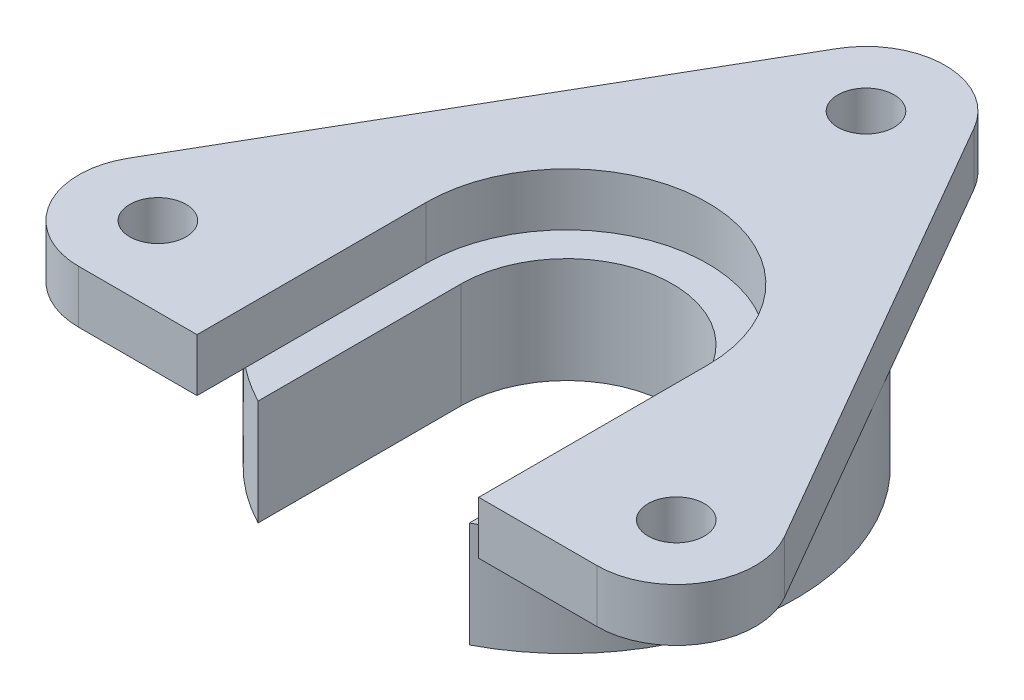
from build123d import *

# Parameters (mm, degrees)
SKETCH_1_R          = 13
SKETCH_1_R_2        = 6
EXTRUDE_1_DEPTH     = 6
SKETCH_2_R          = 8
EXTRUDE_2_DEPTH     = 3
CUT_EXTRUDE_1_DEPTH = 47.127561032
OTHER_START         = -30
OTHER_1_OUTLINE_R   = 1.6
OTHER_1_DEPTH       = 3


# Read off the part's stored shape, not the designer's step: 高级异型孔1
with BuildPart() as part:
    # 草图1 → 凸台-拉伸1 (new body)
    with BuildSketch(Plane(origin=(0, -30, 0), x_dir=(1, 0, 0), z_dir=(0, 1, 0))):
        with Locations(Location((0, 0, 0), (0, 0, 270))):
            Circle(SKETCH_1_R)
        with Locations(Location((0, 0, 0), (0, 0, 270))):
            Circle(SKETCH_1_R_2, mode=Mode.SUBTRACT)
    extrude(amount=-EXTRUDE_1_DEPTH)

    # 草图2 → 凸台-拉伸2 (add)
    with BuildSketch(Plane(origin=(0, -30, 0), x_dir=(1, 0, 0), z_dir=(0, 1, 0))):
        with BuildLine():
            Line((-3.897114317, 19.25), (-18.619546181, -6.25))
            ThreePointArc((-18.619546181, -6.25), (-18.619546181, -10.75), (-14.722431864, -13))
            Line((-14.722431864, -13), (14.722431864, -13))
            ThreePointArc((14.722431864, -13), (18.619546181, -10.75), (18.619546181, -6.25))
            Line((18.619546181, -6.25), (3.897114317, 19.25))
            ThreePointArc((3.897114317, 19.25), (0, 21.5), (-3.897114317, 19.25))
        make_face()
        with Locations(Location((0, 0, 0), (0, 0, 270))):
            Circle(SKETCH_2_R, mode=Mode.SUBTRACT)
    extrude(amount=EXTRUDE_2_DEPTH)

    # 草图3 → 切除-拉伸1 (cut, through all)
    with BuildSketch(Plane.XY):
        Polygon((-8, -27), (-8, -30), (-6, -30), (-6, -36.276321086), (6, -36.276321086), (6, -30), (8, -30), (8, -27), align=None)
    extrude(amount=CUT_EXTRUDE_1_DEPTH, mode=Mode.SUBTRACT)

    # 高级异型孔1 outline → 高级异型孔1 (cut)
    with BuildSketch(Plane(origin=(0, 0, 0), x_dir=(1, 0, 0), z_dir=(0, 1, 0)).offset(OTHER_START)):
        with Locations((-14.722431864, -8.5)):
            Circle(OTHER_1_OUTLINE_R)
        with Locations((14.722431864, -8.5)):
            Circle(OTHER_1_OUTLINE_R)
        with Locations((0, 17)):
            Circle(OTHER_1_OUTLINE_R)
    extrude(amount=OTHER_1_DEPTH, mode=Mode.SUBTRACT)


solid = part.part
